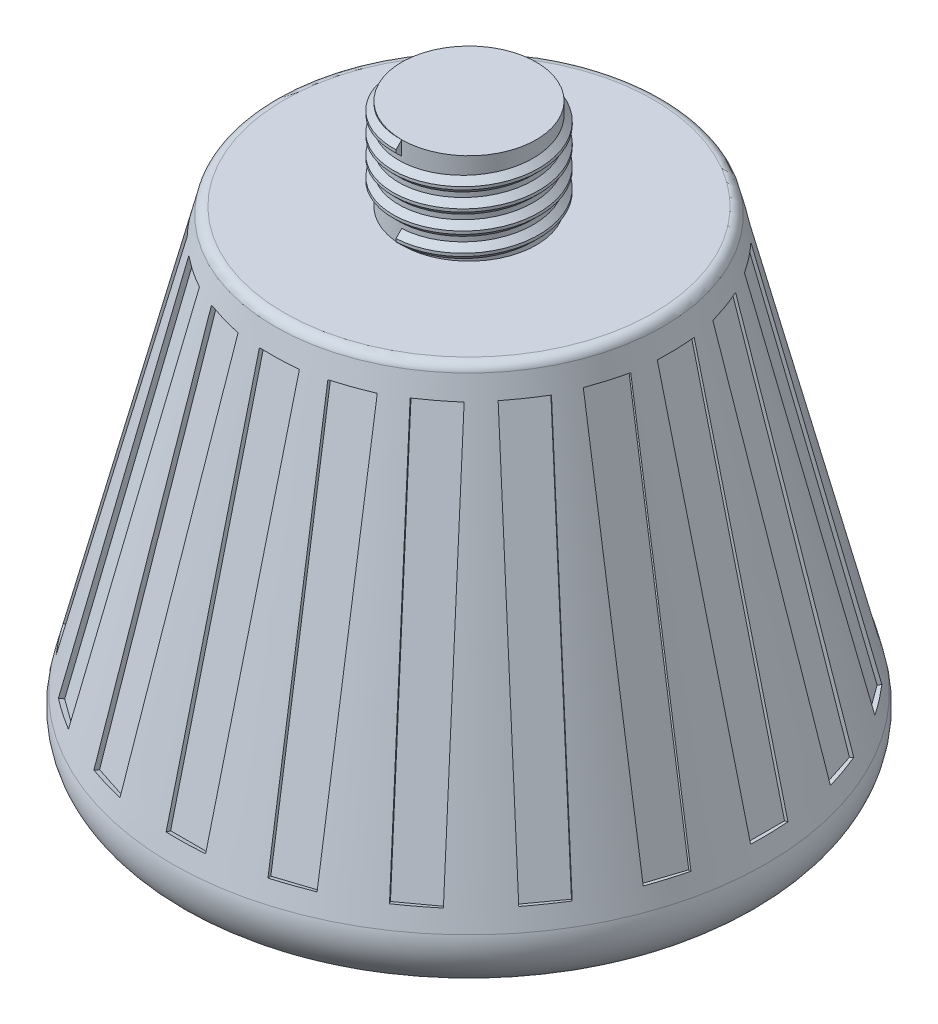
from build123d import *

# Parameters (mm, degrees)
SKETCH1_R               = 20
SKETCH2_R               = 32.5
FILLET1_R               = 5
SKETCH4_R               = 1.5
BOSS_EXTRUDE2_DEPTH     = 1
FILL_START              = -51
FILL_PATTERN1_OUTLINE_R = 1.5
FILL_PATTERN1_DEPTH     = 1
SKETCH6_R               = 15
CUT_EXTRUDE1_DEPTH      = 35
FILLET3_R               = 1
SKETCH7_W               = 4
SKETCH7_H               = 40
CUT_EXTRUDE2_DEPTH      = 0.5
CIRPATTERN1_COUNT       = 20
SKETCH_1_R              = 15
EXTRUDE_1_DEPTH         = 35
SKETCH_3_R              = 48.37596027
CUT_EXTRUDE_1_DEPTH     = 67.587815085
SKETCH_2_R              = 7
EXTRUDE_2_DEPTH         = 9.5
SWEEP_1_PITCH           = 2


# Read off the part's stored shape, not the designer's step: Fill Pattern1
with BuildPart() as part:
    # Sketch1 → Loft1 section 0
    with BuildSketch(Plane(origin=(0, 0, 0), x_dir=(1, 0, 0), z_dir=(0, 1, 0))):
        Circle(SKETCH1_R)
    # Sketch2 → Loft1 section 1
    with BuildSketch(Plane(origin=(0, -50, 0), x_dir=(1, 0, 0), z_dir=(0, 1, 0))):
        Circle(SKETCH2_R)
    loft()

    # Fillet1
    fillet1_edges = [part.edges().sort_by_distance(p)[0] for p in [
        (-32.5, -50, 0),
    ]]
    fillet(fillet1_edges, radius=FILLET1_R)

    # Sketch6 → Cut-Extrude1 (cut)
    with BuildSketch(Plane(origin=(0, 0, 0), x_dir=(1, 0, 0), z_dir=(0, 1, 0))):
        with Locations(Location((0, 0, 0), (0, 0, 270))):
            Circle(SKETCH6_R)
    extrude(amount=-CUT_EXTRUDE1_DEPTH, mode=Mode.SUBTRACT)

    # Fillet3
    fillet3_edges = [part.edges().sort_by_distance(p)[0] for p in [
        (-20, 0, 0),
    ]]
    fillet(fillet3_edges, radius=FILLET3_R)


with BuildPart() as body_2:
    # Sketch4 → Boss-Extrude2 (new body)
    with BuildSketch(Plane.XZ.offset(50)):
        with Locations(Location((0, 0, 0), (0, 0, 270))):
            Circle(SKETCH4_R)
    extrude(amount=BOSS_EXTRUDE2_DEPTH)


with BuildPart() as body_3:
    # Fill Pattern1 outline → Fill Pattern1 (new body)
    with BuildSketch(Plane(origin=(0, 0, 0), x_dir=(1, 0, 0), z_dir=(0, 1, 0)).offset(FILL_START)):
        with Locations((4.389532245, 22.067668809)):
            Circle(FILL_PATTERN1_OUTLINE_R)
        with Locations((8.610377228, 20.787289482)):
            Circle(FILL_PATTERN1_OUTLINE_R)
        with Locations((12.500330243, 18.708066277)):
            Circle(FILL_PATTERN1_OUTLINE_R)
        with Locations((15.909902577, 15.909902577)):
            Circle(FILL_PATTERN1_OUTLINE_R)
        with Locations((18.708066277, 12.500330243)):
            Circle(FILL_PATTERN1_OUTLINE_R)
        with Locations((20.787289482, 8.610377228)):
            Circle(FILL_PATTERN1_OUTLINE_R)
        with Locations((22.067668809, 4.389532245)):
            Circle(FILL_PATTERN1_OUTLINE_R)
        with Locations((22.5, 0)):
            Circle(FILL_PATTERN1_OUTLINE_R)
        with Locations((22.067668809, -4.389532245)):
            Circle(FILL_PATTERN1_OUTLINE_R)
        with Locations((20.787289482, -8.610377228)):
            Circle(FILL_PATTERN1_OUTLINE_R)
        with Locations((18.708066277, -12.500330243)):
            Circle(FILL_PATTERN1_OUTLINE_R)
        with Locations((15.909902577, -15.909902577)):
            Circle(FILL_PATTERN1_OUTLINE_R)
        with Locations((12.500330243, -18.708066277)):
            Circle(FILL_PATTERN1_OUTLINE_R)
        with Locations((8.610377228, -20.787289482)):
            Circle(FILL_PATTERN1_OUTLINE_R)
        with Locations((4.389532245, -22.067668809)):
            Circle(FILL_PATTERN1_OUTLINE_R)
        with Locations((0, -22.5)):
            Circle(FILL_PATTERN1_OUTLINE_R)
        with Locations((-4.389532245, -22.067668809)):
            Circle(FILL_PATTERN1_OUTLINE_R)
        with Locations((-8.610377228, -20.787289482)):
            Circle(FILL_PATTERN1_OUTLINE_R)
        with Locations((-12.500330243, -18.708066277)):
            Circle(FILL_PATTERN1_OUTLINE_R)
        with Locations((-15.909902577, -15.909902577)):
            Circle(FILL_PATTERN1_OUTLINE_R)
        with Locations((-18.708066277, -12.500330243)):
            Circle(FILL_PATTERN1_OUTLINE_R)
        with Locations((-20.787289482, -8.610377228)):
            Circle(FILL_PATTERN1_OUTLINE_R)
        with Locations((-22.067668809, -4.389532245)):
            Circle(FILL_PATTERN1_OUTLINE_R)
        with Locations((-22.5, 0)):
            Circle(FILL_PATTERN1_OUTLINE_R)
        with Locations((-22.067668809, 4.389532245)):
            Circle(FILL_PATTERN1_OUTLINE_R)
        with Locations((-20.787289482, 8.610377228)):
            Circle(FILL_PATTERN1_OUTLINE_R)
        with Locations((-18.708066277, 12.500330243)):
            Circle(FILL_PATTERN1_OUTLINE_R)
        with Locations((-15.909902577, 15.909902577)):
            Circle(FILL_PATTERN1_OUTLINE_R)
        with Locations((-12.500330243, 18.708066277)):
            Circle(FILL_PATTERN1_OUTLINE_R)
        with Locations((-8.610377228, 20.787289482)):
            Circle(FILL_PATTERN1_OUTLINE_R)
        with Locations((-4.389532245, 22.067668809)):
            Circle(FILL_PATTERN1_OUTLINE_R)
        with Locations((0, 22.5)):
            Circle(FILL_PATTERN1_OUTLINE_R)
        with Locations((4.307681957, 17.476952714)):
            Circle(FILL_PATTERN1_OUTLINE_R)
        with Locations((8.365017097, 15.938208462)):
            Circle(FILL_PATTERN1_OUTLINE_R)
        with Locations((11.936207848, 13.473193467)):
            Circle(FILL_PATTERN1_OUTLINE_R)
        with Locations((14.813709586, 10.225165441)):
            Circle(FILL_PATTERN1_OUTLINE_R)
        with Locations((16.830292368, 6.382887967)):
            Circle(FILL_PATTERN1_OUTLINE_R)
        with Locations((17.868759734, 2.169660245)):
            Circle(FILL_PATTERN1_OUTLINE_R)
        with Locations((17.868759734, -2.169660245)):
            Circle(FILL_PATTERN1_OUTLINE_R)
        with Locations((16.830292368, -6.382887967)):
            Circle(FILL_PATTERN1_OUTLINE_R)
        with Locations((14.813709586, -10.225165441)):
            Circle(FILL_PATTERN1_OUTLINE_R)
        with Locations((11.936207848, -13.473193467)):
            Circle(FILL_PATTERN1_OUTLINE_R)
        with Locations((8.365017097, -15.938208462)):
            Circle(FILL_PATTERN1_OUTLINE_R)
        with Locations((4.307681957, -17.476952714)):
            Circle(FILL_PATTERN1_OUTLINE_R)
        with Locations((0, -18)):
            Circle(FILL_PATTERN1_OUTLINE_R)
        with Locations((-4.307681957, -17.476952714)):
            Circle(FILL_PATTERN1_OUTLINE_R)
        with Locations((-8.365017097, -15.938208462)):
            Circle(FILL_PATTERN1_OUTLINE_R)
        with Locations((-11.936207848, -13.473193467)):
            Circle(FILL_PATTERN1_OUTLINE_R)
        with Locations((-14.813709586, -10.225165441)):
            Circle(FILL_PATTERN1_OUTLINE_R)
        with Locations((-16.830292368, -6.382887967)):
            Circle(FILL_PATTERN1_OUTLINE_R)
        with Locations((-17.868759734, -2.169660245)):
            Circle(FILL_PATTERN1_OUTLINE_R)
        with Locations((-17.868759734, 2.169660245)):
            Circle(FILL_PATTERN1_OUTLINE_R)
        with Locations((-16.830292368, 6.382887967)):
            Circle(FILL_PATTERN1_OUTLINE_R)
        with Locations((-14.813709586, 10.225165441)):
            Circle(FILL_PATTERN1_OUTLINE_R)
        with Locations((-11.936207848, 13.473193467)):
            Circle(FILL_PATTERN1_OUTLINE_R)
        with Locations((-8.365017097, 15.938208462)):
            Circle(FILL_PATTERN1_OUTLINE_R)
        with Locations((-4.307681957, 17.476952714)):
            Circle(FILL_PATTERN1_OUTLINE_R)
        with Locations((0, 18)):
            Circle(FILL_PATTERN1_OUTLINE_R)
        with Locations((4.171729424, 12.83926297)):
            Circle(FILL_PATTERN1_OUTLINE_R)
        with Locations((7.935100906, 10.921729424)):
            Circle(FILL_PATTERN1_OUTLINE_R)
        with Locations((10.921729424, 7.935100906)):
            Circle(FILL_PATTERN1_OUTLINE_R)
        with Locations((12.83926297, 4.171729424)):
            Circle(FILL_PATTERN1_OUTLINE_R)
        with Locations((13.5, 0)):
            Circle(FILL_PATTERN1_OUTLINE_R)
        with Locations((12.83926297, -4.171729424)):
            Circle(FILL_PATTERN1_OUTLINE_R)
        with Locations((10.921729424, -7.935100906)):
            Circle(FILL_PATTERN1_OUTLINE_R)
        with Locations((7.935100906, -10.921729424)):
            Circle(FILL_PATTERN1_OUTLINE_R)
        with Locations((4.171729424, -12.83926297)):
            Circle(FILL_PATTERN1_OUTLINE_R)
        with Locations((0, -13.5)):
            Circle(FILL_PATTERN1_OUTLINE_R)
        with Locations((-4.171729424, -12.83926297)):
            Circle(FILL_PATTERN1_OUTLINE_R)
        with Locations((-7.935100906, -10.921729424)):
            Circle(FILL_PATTERN1_OUTLINE_R)
        with Locations((-10.921729424, -7.935100906)):
            Circle(FILL_PATTERN1_OUTLINE_R)
        with Locations((-12.83926297, -4.171729424)):
            Circle(FILL_PATTERN1_OUTLINE_R)
        with Locations((-13.5, 0)):
            Circle(FILL_PATTERN1_OUTLINE_R)
        with Locations((-12.83926297, 4.171729424)):
            Circle(FILL_PATTERN1_OUTLINE_R)
        with Locations((-10.921729424, 7.935100906)):
            Circle(FILL_PATTERN1_OUTLINE_R)
        with Locations((-7.935100906, 10.921729424)):
            Circle(FILL_PATTERN1_OUTLINE_R)
        with Locations((-4.171729424, 12.83926297)):
            Circle(FILL_PATTERN1_OUTLINE_R)
        with Locations((0, 13.5)):
            Circle(FILL_PATTERN1_OUTLINE_R)
        with Locations((3.904953652, 8.108719811)):
            Circle(FILL_PATTERN1_OUTLINE_R)
        with Locations((7.036483342, 5.611408217)):
            Circle(FILL_PATTERN1_OUTLINE_R)
        with Locations((8.77435121, 2.002688406)):
            Circle(FILL_PATTERN1_OUTLINE_R)
        with Locations((8.77435121, -2.002688406)):
            Circle(FILL_PATTERN1_OUTLINE_R)
        with Locations((7.036483342, -5.611408217)):
            Circle(FILL_PATTERN1_OUTLINE_R)
        with Locations((3.904953652, -8.108719811)):
            Circle(FILL_PATTERN1_OUTLINE_R)
        with Locations((0, -9)):
            Circle(FILL_PATTERN1_OUTLINE_R)
        with Locations((-3.904953652, -8.108719811)):
            Circle(FILL_PATTERN1_OUTLINE_R)
        with Locations((-7.036483342, -5.611408217)):
            Circle(FILL_PATTERN1_OUTLINE_R)
        with Locations((-8.77435121, -2.002688406)):
            Circle(FILL_PATTERN1_OUTLINE_R)
        with Locations((-8.77435121, 2.002688406)):
            Circle(FILL_PATTERN1_OUTLINE_R)
        with Locations((-7.036483342, 5.611408217)):
            Circle(FILL_PATTERN1_OUTLINE_R)
        with Locations((-3.904953652, 8.108719811)):
            Circle(FILL_PATTERN1_OUTLINE_R)
        with Locations((0, 9)):
            Circle(FILL_PATTERN1_OUTLINE_R)
        with Locations((3.897114317, 2.25)):
            Circle(FILL_PATTERN1_OUTLINE_R)
        with Locations((3.897114317, -2.25)):
            Circle(FILL_PATTERN1_OUTLINE_R)
        with Locations((0, -4.5)):
            Circle(FILL_PATTERN1_OUTLINE_R)
        with Locations((-3.897114317, -2.25)):
            Circle(FILL_PATTERN1_OUTLINE_R)
        with Locations((-3.897114317, 2.25)):
            Circle(FILL_PATTERN1_OUTLINE_R)
        with Locations((0, 4.5)):
            Circle(FILL_PATTERN1_OUTLINE_R)
    extrude(amount=FILL_PATTERN1_DEPTH)


with BuildPart() as body_2_1:
    # Body-Move/Copy2: moved
    add(body_2.part.moved(Location((0, 0.4, 0))))


with BuildPart() as body_3_1:
    # Body-Move/Copy2: moved
    add(body_3.part.moved(Location((0, 0.4, 0))))


with BuildPart() as body_2_2:
    add(body_2_1.part)

    # Combine2: union body 3, part
    add(body_3_1.part)
    add(part.part)

    # Sketch7 → Cut-Extrude2 (cut)
    with BuildSketch(Plane(origin=(18.823529412, 4.705882353, 0), x_dir=(0, 0, -1), z_dir=(0.9701425001453319, 0.24253562503633294, 0))):
        with Locations((0.891721975, -27.875356133)):
            Rectangle(SKETCH7_W, SKETCH7_H)
    cut_extrude2 = extrude(amount=-CUT_EXTRUDE2_DEPTH, mode=Mode.SUBTRACT)

    # CirPattern1: Cut-Extrude2 ×20 about axis
    cirpattern1_axis = Axis((0, 0, 0), (0, 1, 0))
    for i in range(1, CIRPATTERN1_COUNT):
        add(cut_extrude2.rotate(cirpattern1_axis, i * 360 / CIRPATTERN1_COUNT), mode=Mode.SUBTRACT)

    # 草图1 → 凸台-拉伸1 (add)
    with BuildSketch(Plane(origin=(0, -35, 0), x_dir=(1, 0, 0), z_dir=(0, 1, 0))):
        Circle(SKETCH_1_R)
    extrude(amount=EXTRUDE_1_DEPTH)

    # 草图3 → 切除-拉伸1 (cut, through all)
    with BuildSketch(Plane.XZ.offset(50)):
        Circle(SKETCH_3_R)
    extrude(amount=CUT_EXTRUDE_1_DEPTH, mode=Mode.SUBTRACT)

    # 草图2 → 凸台-拉伸2 (add)
    with BuildSketch(Plane(origin=(0, 0, 0), x_dir=(1, 0, 0), z_dir=(0, 1, 0))):
        with Locations(Location((0, 0, 0), (0, 0, 270))):
            Circle(SKETCH_2_R)
    extrude(amount=EXTRUDE_2_DEPTH)

    # 扫描1: the profile of 草图6 profile screwed along a right-hand helix of 4 turns, 10 arcs to a turn; built about Z, then put on its axis
    sweep_1_z = Axis((0, 0, 0), (0, 0, 1))
    sweep_1_corners = [(6.9997, 0, 0.7503), (6.9997, 0, -0.7503), (7.6, 0, -0.15), (7.6, 0, 0.15)]
    with BuildLine(mode=Mode.PRIVATE) as sweep_1_profile:
        Line(sweep_1_corners[0], sweep_1_corners[1])
        Line(sweep_1_corners[1], sweep_1_corners[2])
        Line(sweep_1_corners[2], sweep_1_corners[3])
        Line(sweep_1_corners[3], sweep_1_corners[0])
    sweep_1_cap = Face(sweep_1_profile.wire())
    sweep_1_turn_angles = [0, 18, 36, 54, 72, 90, 108, 126, 144, 162, 180, 198, 216, 234, 252, 270, 288, 306, 324, 342, 360]
    sweep_1_turn_weights = [1, 0.9510565162951535, 1, 0.9510565162951535, 1, 0.9510565162951535, 1, 0.9510565162951535, 1, 0.9510565162951535, 1, 0.9510565162951535, 1, 0.9510565162951535, 1, 0.9510565162951535, 1, 0.9510565162951535, 1, 0.9510565162951535, 1]
    sweep_1_turn_rails = [Edge.make_bspline([Vector(p[0], p[1], 0).rotate(sweep_1_z, sweep_1_turn_angles[k]) / sweep_1_turn_weights[k] + Vector(0, 0, p[2] + SWEEP_1_PITCH * sweep_1_turn_angles[k] / 360) for k in range(21)], [0, 0, 0, 1, 1, 2, 2, 3, 3, 4, 4, 5, 5, 6, 6, 7, 7, 8, 8, 9, 9, 10, 10, 10], 2, sweep_1_turn_weights) for p in sweep_1_corners]
    sweep_1_turn_sides = [Face.make_surface_from_curves(sweep_1_turn_rails[p[0]], sweep_1_turn_rails[p[1]]) for p in [(0, 1), (1, 2), (2, 3), (3, 0)]]
    sweep_1 = Plane(origin=(0, 0.75, 0), x_dir=(0, 0, 1), z_dir=(0, 1, 0)) * Solid(Shell([*[p.moved(Location((0, 0, SWEEP_1_PITCH * i))) for i in range(4) for p in sweep_1_turn_sides], sweep_1_cap, sweep_1_cap.rotate(sweep_1_z, 1440).moved(Location((0, 0, SWEEP_1_PITCH * 1440 / 360)))]))
    add(sweep_1)


solid = body_2_2.part
